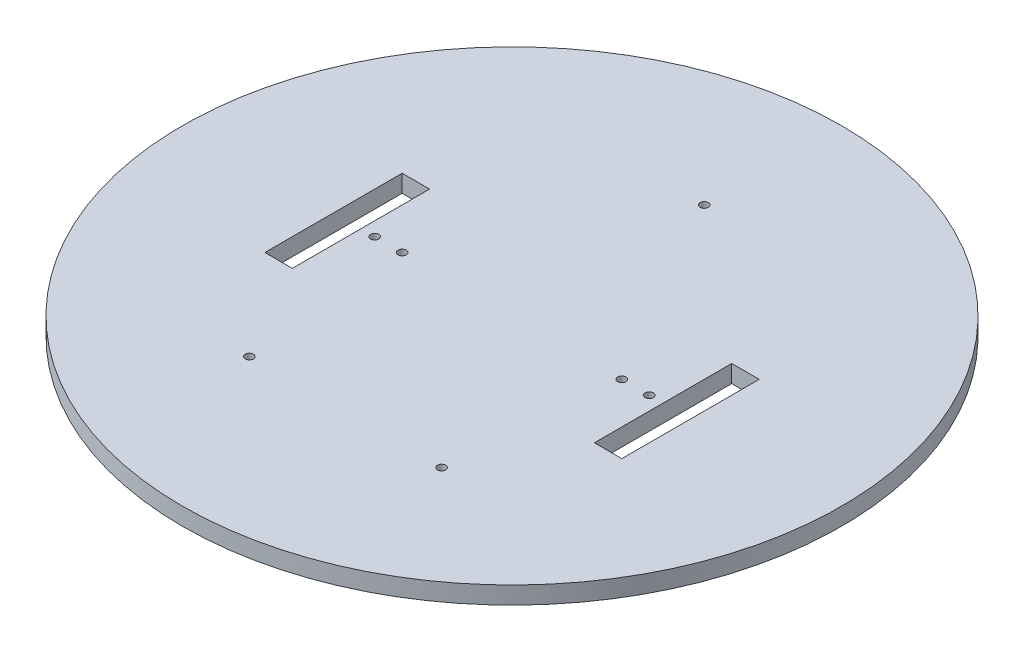
from build123d import *

# Parameters (mm, degrees)
SKETCH1_R           = 120
BOSS_EXTRUDE1_DEPTH = 6.35
SKETCH2_W           = 10
SKETCH2_H           = 50
CUT_EXTRUDE1_DEPTH  = 170.824387236
SKETCH3_R           = 1.5
CUT_EXTRUDE2_DEPTH  = 170.824387236
SKETCH4_R           = 1.5
CUT_EXTRUDE3_DEPTH  = 170.824387236


with BuildPart() as part:
    # Sketch1 → Boss-Extrude1 (new body)
    with BuildSketch(Plane(origin=(0, 0, 0), x_dir=(1, 0, 0), z_dir=(0, 1, 0))):
        Circle(SKETCH1_R)
    extrude(amount=BOSS_EXTRUDE1_DEPTH)

    # Sketch2 → Cut-Extrude1 (cut, through all)
    with BuildSketch(Plane(origin=(0, 6.35, 0), x_dir=(1, 0, 0), z_dir=(0, 1, 0))):
        with Locations((-60, 0)):
            Rectangle(SKETCH2_W, SKETCH2_H)
        with Locations((60, 0)):
            Rectangle(SKETCH2_W, SKETCH2_H)
    extrude(amount=-CUT_EXTRUDE1_DEPTH, mode=Mode.SUBTRACT)

    # Sketch3 → Cut-Extrude2 (cut, through all)
    with BuildSketch(Plane(origin=(0, 6.35, 0), x_dir=(1, 0, 0), z_dir=(0, 1, 0))):
        with Locations((0, 70)):
            Circle(SKETCH3_R)
        with Locations((-35, -60.621778265)):
            Circle(SKETCH3_R)
        with Locations((35, -60.621778265)):
            Circle(SKETCH3_R)
    extrude(amount=-CUT_EXTRUDE2_DEPTH, mode=Mode.SUBTRACT)

    # Sketch4 → Cut-Extrude3 (cut, through all)
    with BuildSketch(Plane.XZ):
        with Locations((-50, 0)):
            Circle(SKETCH4_R)
        with Locations((-40, 0)):
            Circle(SKETCH4_R)
        with Locations((40, 0)):
            Circle(SKETCH4_R)
        with Locations((50, 0)):
            Circle(SKETCH4_R)
    extrude(amount=-CUT_EXTRUDE3_DEPTH, mode=Mode.SUBTRACT)


solid = part.part
